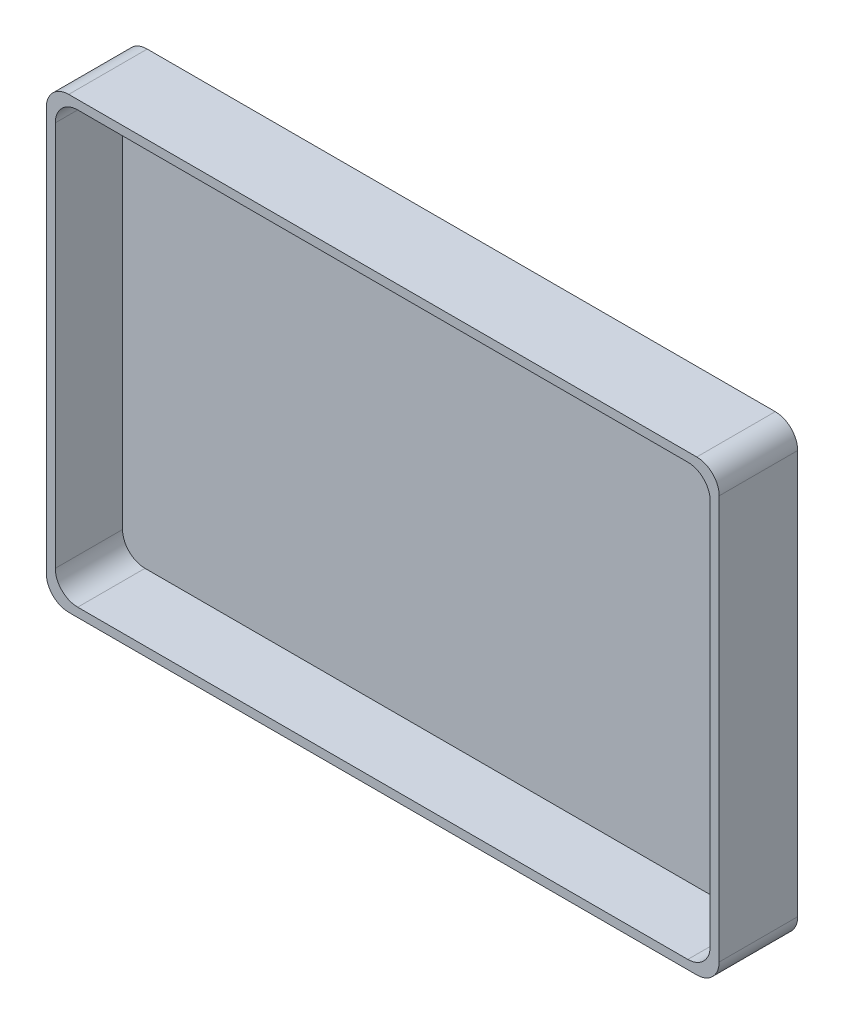
from build123d import *

# Parameters (mm, degrees)
ESQUISSE1_W        = 600
ESQUISSE1_H        = 400
BOSS_EXTRU_1_DEPTH = 10
ESQUISSE2_W        = 600
ESQUISSE2_H        = 400
ESQUISSE2_W_2      = 584
ESQUISSE2_H_2      = 384
BOSS_EXTRU_2_DEPTH = 60
CONG_1_R           = 20


with BuildPart() as part:
    # Esquisse1 → Boss.-Extru.1 (new body)
    with BuildSketch(Plane.XY):
        with Locations((300, 200)):
            Rectangle(ESQUISSE1_W, ESQUISSE1_H)
    extrude(amount=BOSS_EXTRU_1_DEPTH)

    # Esquisse2 → Boss.-Extru.2 (add)
    with BuildSketch(Plane.XY.offset(10)):
        with Locations((300, 200)):
            Rectangle(ESQUISSE2_W, ESQUISSE2_H)
        with Locations((300, 200)):
            Rectangle(ESQUISSE2_W_2, ESQUISSE2_H_2, mode=Mode.SUBTRACT)
    extrude(amount=BOSS_EXTRU_2_DEPTH)

    # Congé1
    cong_1_edges = [part.edges().sort_by_distance(p)[0] for p in [
        (8, 8, 40),
        (0, 0, 35),
        (8, 392, 40),
        (0, 400, 35),
        (600, 400, 35),
        (592, 392, 40),
        (592, 8, 40),
        (600, 0, 35),
    ]]
    fillet(cong_1_edges, radius=CONG_1_R)


solid = part.part
